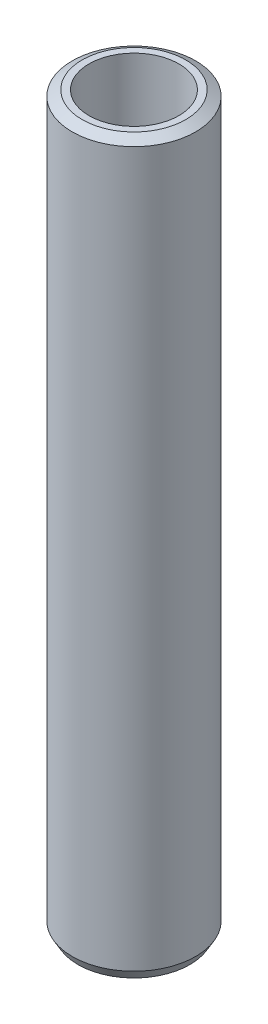
from build123d import *
from OCP.BRepFilletAPI import BRepFilletAPI_MakeChamfer

# Parameters (mm, degrees)
SKETCH1_R           = 50
BOSS_EXTRUDE1_DEPTH = 591.661672504
SKETCH2_R           = 36.417131601
CUT_EXTRUDE1_DEPTH  = 596.87207915
CHAMFER1_SIZE       = 4.628701169
CHAMFER1_SIZE2      = 8.017145598


with BuildPart() as part:
    # Sketch1 → Boss-Extrude1 (new body)
    with BuildSketch(Plane(origin=(0, 0, 0), x_dir=(1, 0, 0), z_dir=(0, 1, 0))):
        Circle(SKETCH1_R)
    extrude(amount=BOSS_EXTRUDE1_DEPTH)

    # Sketch2 → Cut-Extrude1 (cut, through all)
    with BuildSketch(Plane(origin=(0, 0, 0), x_dir=(1, 0, 0), z_dir=(0, 1, 0))):
        Circle(SKETCH2_R)
    extrude(amount=CUT_EXTRUDE1_DEPTH, mode=Mode.SUBTRACT)

    # Chamfer1: one chamfer whose edges measure the first distance from different faces: ONE call of the kernel's chamfer builder (chamfer() names one face for all edges)
    chamfer1_edges_1 = [part.edges().sort_by_distance(p)[0] for p in [
        (-50, 591.661672504, 0),
    ]]
    chamfer1_side_1 = [part.faces().sort_by_distance(p)[0] for p in [
        (-50, 295.830836252, 0),
    ]]
    chamfer1_edges_2 = [part.edges().sort_by_distance(p)[0] for p in [
        (-50, 0, 0),
    ]]
    chamfer1_side_2 = [part.faces().sort_by_distance(p)[0] for p in [
        (-48.585786438, 0, 0),
    ]]
    chamfer1 = BRepFilletAPI_MakeChamfer(part.part.solid().wrapped)
    for e in chamfer1_edges_1:
        chamfer1.Add(CHAMFER1_SIZE, CHAMFER1_SIZE2, e.wrapped, chamfer1_side_1[0].wrapped)  # the first distance lies on this face
    for e in chamfer1_edges_2:
        chamfer1.Add(CHAMFER1_SIZE, CHAMFER1_SIZE2, e.wrapped, chamfer1_side_2[0].wrapped)  # the first distance lies on this face
    add(Compound.cast(chamfer1.Shape()), mode=Mode.REPLACE)


solid = part.part
